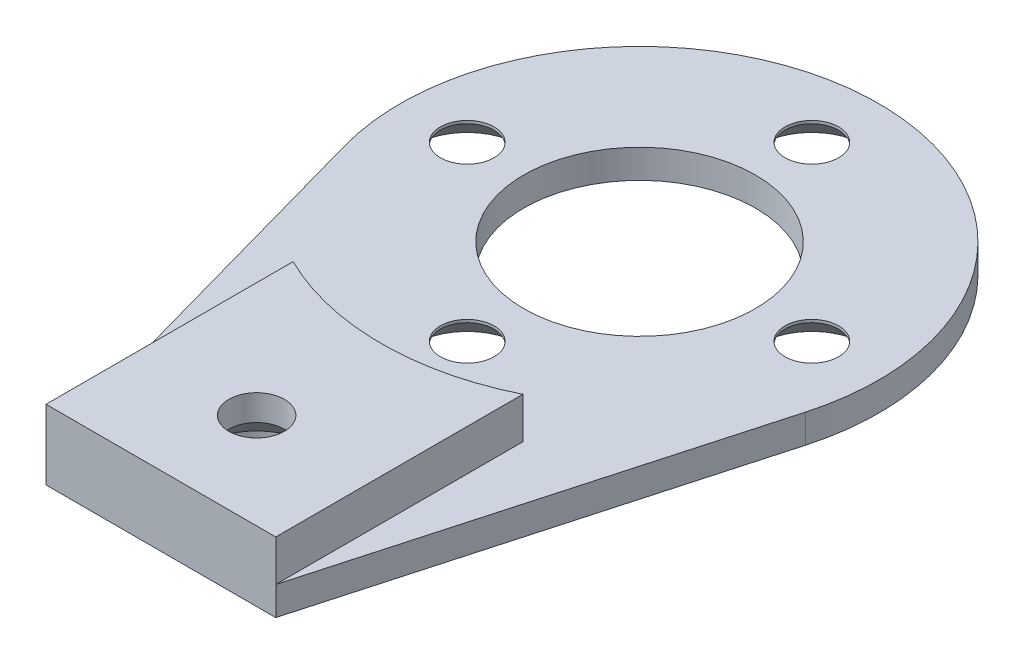
from build123d import *

# Parameters (mm, degrees)
BOSS_EXTRUDE1_DEPTH                               = 1.5
BOSS_EXTRUDE2_DEPTH                               = 2.15
CSK_FOR_M2_5_FLAT_HEAD_MACHINE_SCREW1_D           = 2.8
CSK_FOR_M2_5_FLAT_HEAD_MACHINE_SCREW1_CSINK_D     = 5.5
CSK_FOR_M2_5_FLAT_HEAD_MACHINE_SCREW1_CSINK_ANGLE = 90
SKETCH6_R                                         = 6.05
CUT_EXTRUDE1_DEPTH                                = 29.188162409
SKETCH7_R                                         = 2.75
CUT_EXTRUDE2_DEPTH                                = 1
CSK_FOR_M2_5_FLAT_HEAD_MACHINE_SCREW2_D           = 2.9
CSK_FOR_M2_5_FLAT_HEAD_MACHINE_SCREW2_DEPTH       = 8
CSK_FOR_M2_5_FLAT_HEAD_MACHINE_SCREW2_CSINK_D     = 5.5
CSK_FOR_M2_5_FLAT_HEAD_MACHINE_SCREW2_CSINK_ANGLE = 90
CSK_FOR_M2_5_FLAT_HEAD_MACHINE_SCREW2_TIP         = 0.871247898


with BuildPart() as part:
    # Sketch1 → Boss-Extrude1 (new body)
    with BuildSketch(Plane(origin=(0, 0, 0), x_dir=(1, 0, 0), z_dir=(0, 1, 0))):
        with BuildLine():
            Line((-12.039826938, -3.360441535), (-6, -25))
            Line((-6, -25), (6, -25))
            Line((6, -25), (12.039826938, -3.360441535))
            ThreePointArc((12.039826938, -3.360441535), (0, 12.5), (-12.039826938, -3.360441535))
        make_face()
    extrude(amount=BOSS_EXTRUDE1_DEPTH)

    # Sketch2 → Boss-Extrude2 (add)
    with BuildSketch(Plane(origin=(0, 1.5, 0), x_dir=(1, 0, 0), z_dir=(0, 1, 0))):
        with BuildLine():
            Line((-6, -25), (-6, -12.093386622))
            ThreePointArc((-6, -12.093386622), (0, -13.5), (6, -12.093386622))
            Line((6, -12.093386622), (6, -25))
            Line((6, -25), (-6, -25))
        make_face()
    extrude(amount=BOSS_EXTRUDE2_DEPTH)

    # CSK for M2.5 Flat Head Machine Screw1 (through all)
    with Locations(Plane(origin=(0, 0, 0), x_dir=(-1, 0, 0), z_dir=(0, -1, 0))):
        with Locations((0, -9), (9, 0), (0, 9), (-9, 0)):
            CounterSinkHole(CSK_FOR_M2_5_FLAT_HEAD_MACHINE_SCREW1_D / 2, CSK_FOR_M2_5_FLAT_HEAD_MACHINE_SCREW1_CSINK_D / 2, counter_sink_angle=CSK_FOR_M2_5_FLAT_HEAD_MACHINE_SCREW1_CSINK_ANGLE)

    # Sketch6 → Cut-Extrude1 (cut, through all)
    with BuildSketch(Plane.XZ):
        Circle(SKETCH6_R)
    extrude(amount=-CUT_EXTRUDE1_DEPTH, mode=Mode.SUBTRACT)

    # Sketch7 → Cut-Extrude2 (cut)
    with BuildSketch(Plane(origin=(0, 0, 0), x_dir=(-1, 0, 0), z_dir=(0, -1, 0))):
        with Locations((0, -20)):
            Circle(SKETCH7_R)
    extrude(amount=-CUT_EXTRUDE2_DEPTH, mode=Mode.SUBTRACT)

    # CSK for M2.5 Flat Head Machine Screw2
    with Locations(Plane(origin=(0, 1, 0), x_dir=(-1, 0, 0), z_dir=(0, -1, 0))):
        with Locations((0, -20)):
            CounterSinkHole(CSK_FOR_M2_5_FLAT_HEAD_MACHINE_SCREW2_D / 2, CSK_FOR_M2_5_FLAT_HEAD_MACHINE_SCREW2_CSINK_D / 2, depth=CSK_FOR_M2_5_FLAT_HEAD_MACHINE_SCREW2_DEPTH, counter_sink_angle=CSK_FOR_M2_5_FLAT_HEAD_MACHINE_SCREW2_CSINK_ANGLE)
            with Locations((0, 0, -(CSK_FOR_M2_5_FLAT_HEAD_MACHINE_SCREW2_DEPTH + CSK_FOR_M2_5_FLAT_HEAD_MACHINE_SCREW2_TIP / 2))):  # 118° drill point
                Cone(0, CSK_FOR_M2_5_FLAT_HEAD_MACHINE_SCREW2_D / 2, CSK_FOR_M2_5_FLAT_HEAD_MACHINE_SCREW2_TIP, mode=Mode.SUBTRACT)


solid = part.part
